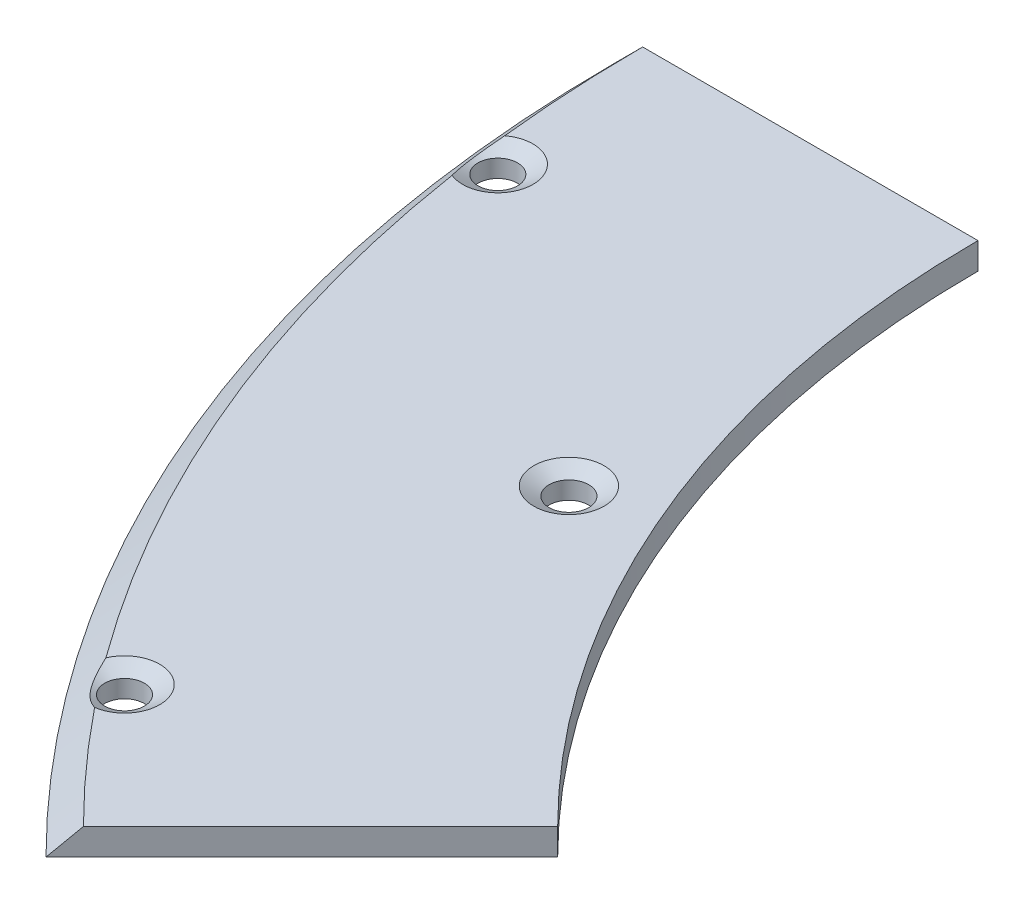
from build123d import *
from OCP.BRepFilletAPI import BRepFilletAPI_MakeChamfer

# Parameters (mm, degrees)
SKETCH1_R           = 2.25
BOSS_EXTRUDE1_DEPTH = 3
CHAMFER2_SIZE       = 1
CHAMFER2_SIZE2      = 1.732050808
SKETCH2_R           = 2.25
CUT_EXTRUDE1_DEPTH  = 192.083751272
CHAMFER1_SIZE       = 3
CHAMFER3_SIZE       = 1
CHAMFER3_SIZE2      = 1.732050808


with BuildPart() as part:
    # Sketch1 → Boss-Extrude1 (new body)
    with BuildSketch(Plane(origin=(0, 0, 0), x_dir=(1, 0, 0), z_dir=(0, 1, 0))):
        with BuildLine():
            Line((-115, 0), (-156, 0))
            ThreePointArc((-156, 0), (-144.125207072, -59.698615449), (-110.308657865, -110.308657865))
            Line((-110.308657865, -110.308657865), (-81.317279836, -81.317279836))
            ThreePointArc((-81.317279836, -81.317279836), (-106.246146239, -44.008594722), (-115, 0))
        make_face()
        with Locations(Location((-149.708174067, -19.709455025, 0), (0, 0, 270))):
            Circle(SKETCH1_R, mode=Mode.SUBTRACT)
        with Locations(Location((-119.796354384, -91.92297578, 0), (0, 0, 270))):
            Circle(SKETCH1_R, mode=Mode.SUBTRACT)
    extrude(amount=BOSS_EXTRUDE1_DEPTH)

    # Chamfer2: one chamfer whose edges measure the first distance from different faces: ONE call of the kernel's chamfer builder (chamfer() names one face for all edges)
    chamfer2_edges_1 = [part.edges().sort_by_distance(p)[0] for p in [
        (-149.708174067, 3, 17.459455025),
    ]]
    chamfer2_side_1 = [part.faces().sort_by_distance(p)[0] for p in [
        (-149.708174067, 1.5, 17.459455025),
    ]]
    chamfer2_edges_2 = [part.edges().sort_by_distance(p)[0] for p in [
        (-119.796354384, 3, 89.67297578),
    ]]
    chamfer2_side_2 = [part.faces().sort_by_distance(p)[0] for p in [
        (-119.796354384, 1.5, 89.67297578),
    ]]
    chamfer2 = BRepFilletAPI_MakeChamfer(part.part.solid().wrapped)
    for e in chamfer2_edges_1:
        chamfer2.Add(CHAMFER2_SIZE, CHAMFER2_SIZE2, e.wrapped, chamfer2_side_1[0].wrapped)  # the first distance lies on this face
    for e in chamfer2_edges_2:
        chamfer2.Add(CHAMFER2_SIZE, CHAMFER2_SIZE2, e.wrapped, chamfer2_side_2[0].wrapped)  # the first distance lies on this face
    add(Compound.cast(chamfer2.Shape()), mode=Mode.REPLACE)

    # Sketch2 → Cut-Extrude1 (cut, through all)
    with BuildSketch(Plane(origin=(0, 3, 0), x_dir=(1, 0, 0), z_dir=(0, 1, 0))):
        with Locations(Location((-114.099122265, -47.261403897, 0), (0, 0, 270))):
            Circle(SKETCH2_R)
    extrude(amount=-CUT_EXTRUDE1_DEPTH, mode=Mode.SUBTRACT)

    # Chamfer1
    # the kernel refuses this chamfer: 3 mm, written as the material it takes off along each edge
    with BuildSketch(Plane(origin=(0, 3, 0), x_dir=(-0.9987770833709343, 0, -0.04944024406341062), z_dir=(0.04944024406341062, 0, -0.9987770833709343))) as chamfer1_piece_1:
        Polygon((156 - CHAMFER1_SIZE, 0), (156, -CHAMFER1_SIZE), (156, 0), align=None)
    revolve(axis=Axis((0, 3, 0), (0, 1, 0)), revolution_arc=50.667745228, mode=Mode.SUBTRACT)

    # Chamfer3
    chamfer3_edges = [part.edges().sort_by_distance(p)[0] for p in [
        (-114.099122265, 3, 45.011403897),
    ]]
    chamfer3_side = [part.faces().sort_by_distance(p)[0] for p in [
        (-114.099122265, 1.5, 45.011403897),
    ]]
    chamfer(chamfer3_edges, length=CHAMFER3_SIZE, length2=CHAMFER3_SIZE2, reference=chamfer3_side[0])


solid = part.part
